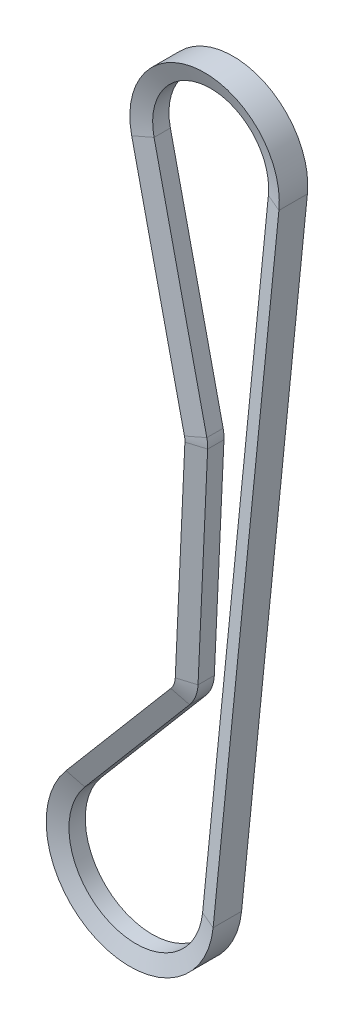
from build123d import *


with BuildPart() as part:
    # Sweep1: sweep along a path in Sketch2
    with BuildLine(Plane.XY) as sweep1_path:
        Line((24.874441615, -2.50242969), (2.855107882, -221.377163138))
        ThreePointArc((2.855107882, -221.377163138), (-35.951554071, -244.345683605), (-46.363550615, -200.469718973))
        Line((-46.363550615, -200.469718973), (-11.308829358, -159.113452621))
        ThreePointArc((-11.308829358, -159.113452621), (-10.24311703, -157.330926461), (-9.809541742, -155.299878766))
        Line((-9.809541742, -155.299878766), (-6.587131285, -85.374089025))
        ThreePointArc((-6.587131285, -85.374089025), (-6.604968858, -84.523712093), (-6.736296177, -83.683347742))
        Line((-6.736296177, -83.683347742), (-24.386232983, -5.505600868))
        ThreePointArc((-24.386232983, -5.505600868), (-1.521297538, 24.953670147), (24.874441615, -2.50242969))
    # Sketch3 → Sweep1 (sweep)
    with BuildSketch(Plane(origin=(-24.386232983, -5.505600868, 0), x_dir=(0.9754493193012622, 0.22022403473441401, 0), z_dir=(-0.22022403473441401, 0.9754493193012622, 0))):
        Polygon((0, -4.7625), (0, 4.7625), (5.588, 2.728634331), (5.588, -2.728634331), align=None)
    sweep(path=sweep1_path.line)


solid = part.part
